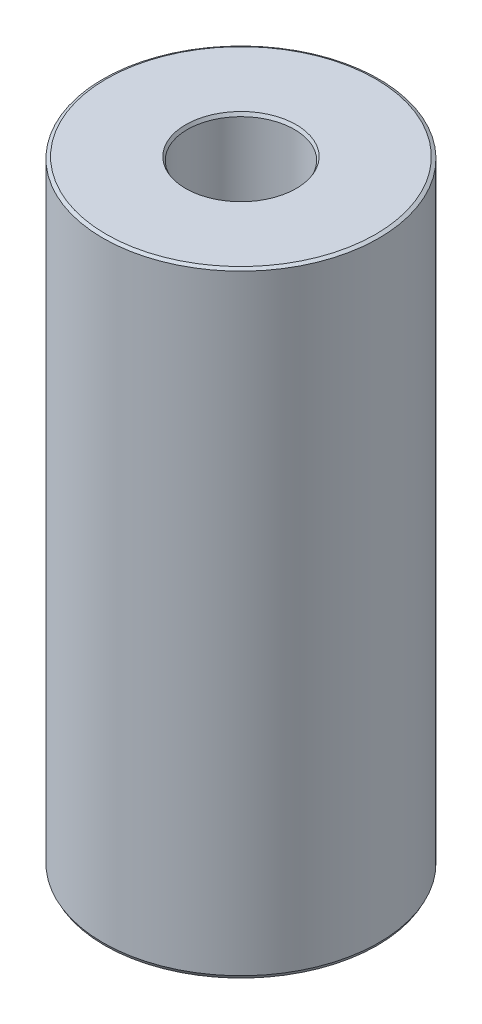
from build123d import *
from OCP.BRepFilletAPI import BRepFilletAPI_MakeChamfer

# Parameters (mm, degrees)
SKETCH1_R           = 47.5
BOSS_EXTRUDE1_DEPTH = 211.863747381
SKETCH2_R           = 18.455994807
CUT_EXTRUDE1_DEPTH  = 223.258289957
CHAMFER1_SIZE       = 0.592474408
CHAMFER1_SIZE2      = 1.12478003


with BuildPart() as part:
    # Sketch1 → Boss-Extrude1 (new body)
    with BuildSketch(Plane(origin=(0, 0, 0), x_dir=(1, 0, 0), z_dir=(0, 1, 0))):
        Circle(SKETCH1_R)
    extrude(amount=BOSS_EXTRUDE1_DEPTH)

    # Sketch2 → Cut-Extrude1 (cut, through all)
    with BuildSketch(Plane(origin=(0, 0, 0), x_dir=(1, 0, 0), z_dir=(0, 1, 0))):
        Circle(SKETCH2_R)
    extrude(amount=CUT_EXTRUDE1_DEPTH, mode=Mode.SUBTRACT)

    # Chamfer1: one chamfer whose edges measure the first distance from different faces: ONE call of the kernel's chamfer builder (chamfer() names one face for all edges)
    chamfer1_edges_1 = [part.edges().sort_by_distance(p)[0] for p in [
        (-18.455994807, 211.863747381, 0),
    ]]
    chamfer1_side_1 = [part.faces().sort_by_distance(p)[0] for p in [
        (-46.156497116, 211.863747381, 0),
    ]]
    chamfer1_edges_2 = [part.edges().sort_by_distance(p)[0] for p in [
        (-18.455994807, 0, 0),
    ]]
    chamfer1_side_2 = [part.faces().sort_by_distance(p)[0] for p in [
        (-18.455994807, 105.931873691, 0),
    ]]
    chamfer1_edges_3 = [part.edges().sort_by_distance(p)[0] for p in [
        (-47.5, 0, 0),
    ]]
    chamfer1_side_3 = [part.faces().sort_by_distance(p)[0] for p in [
        (-46.156497116, 0, 0),
    ]]
    chamfer1_edges_4 = [part.edges().sort_by_distance(p)[0] for p in [
        (-47.5, 211.863747381, 0),
    ]]
    chamfer1_side_4 = [part.faces().sort_by_distance(p)[0] for p in [
        (-47.5, 105.931873691, 0),
    ]]
    chamfer1 = BRepFilletAPI_MakeChamfer(part.part.solid().wrapped)
    for e in chamfer1_edges_1:
        chamfer1.Add(CHAMFER1_SIZE, CHAMFER1_SIZE2, e.wrapped, chamfer1_side_1[0].wrapped)  # the first distance lies on this face
    for e in chamfer1_edges_2:
        chamfer1.Add(CHAMFER1_SIZE, CHAMFER1_SIZE2, e.wrapped, chamfer1_side_2[0].wrapped)  # the first distance lies on this face
    for e in chamfer1_edges_3:
        chamfer1.Add(CHAMFER1_SIZE, CHAMFER1_SIZE2, e.wrapped, chamfer1_side_3[0].wrapped)  # the first distance lies on this face
    for e in chamfer1_edges_4:
        chamfer1.Add(CHAMFER1_SIZE, CHAMFER1_SIZE2, e.wrapped, chamfer1_side_4[0].wrapped)  # the first distance lies on this face
    add(Compound.cast(chamfer1.Shape()), mode=Mode.REPLACE)


solid = part.part
